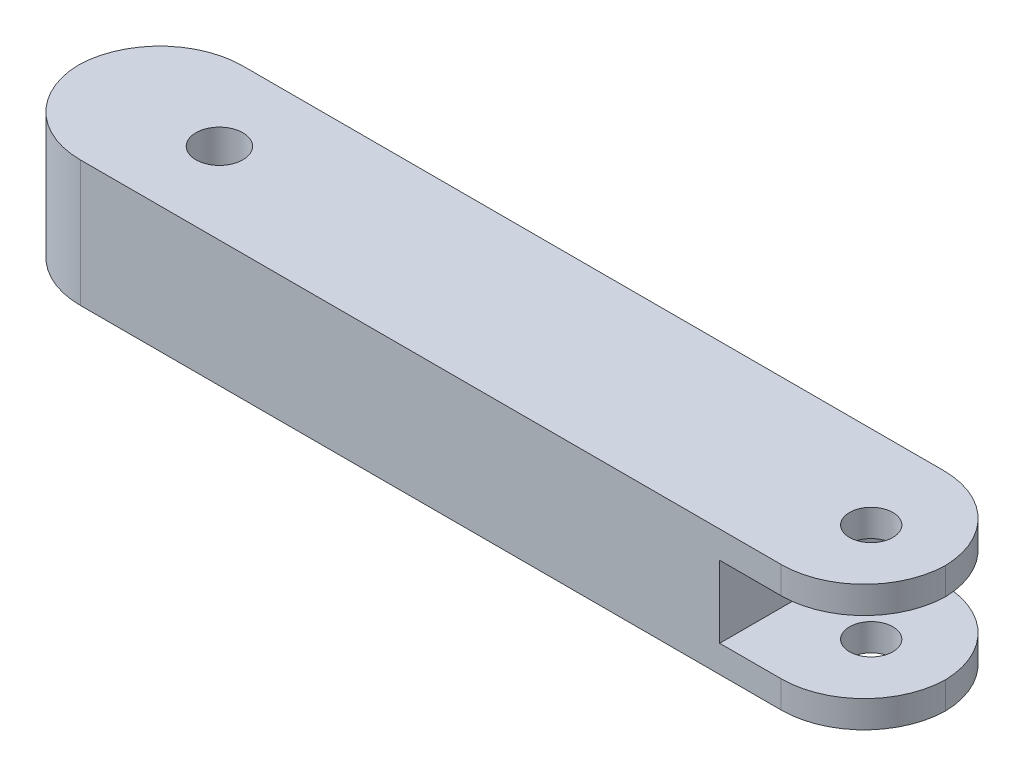
from build123d import *

# Parameters (mm, degrees)
SKETCH1_W           = 240
SKETCH1_H           = 45
BOSS_EXTRUDE1_DEPTH = 34.9
FILLET1_R           = 23
CUT_EXTRUDE1_START  = -7.5
SKETCH2_W           = 49.564850137
SKETCH2_H           = 45.01227926
CUT_EXTRUDE1_DEPTH  = 19.9
SKETCH3_R           = 6
CUT_EXTRUDE2_DEPTH  = 154.260575491
SKETCH4_R           = 6.5
CUT_EXTRUDE3_DEPTH  = 154.260575491
SCALE1_SCALE        = 0.31


with BuildPart() as part:
    # Sketch1 → Boss-Extrude1 (new body)
    with BuildSketch(Plane(origin=(0, 0, 0), x_dir=(1, 0, 0), z_dir=(0, 1, 0))):
        with Locations((24.613815765, -14.36746988)):
            Rectangle(SKETCH1_W, SKETCH1_H)
    extrude(amount=BOSS_EXTRUDE1_DEPTH)

    # Fillet1
    # the kernel refuses this fillet: 23 mm, written as the material it takes off along each edge
    with BuildSketch(Plane(origin=(-95.386184235, -57.5, 36.86746988), x_dir=(1, 0, 0), z_dir=(0, 1, 0))) as fillet1_piece_1:
        with BuildLine():
            CenterArc((FILLET1_R, FILLET1_R), FILLET1_R, 180, 90)
            Line((0, FILLET1_R), (0, 0))
            Line((0, 0), (FILLET1_R, 0))
        make_face()
    extrude(amount=149.9, mode=Mode.SUBTRACT)
    with BuildSketch(Plane(origin=(-95.386184235, -57.5, -8.13253012), x_dir=(1, 0, 0), z_dir=(0, 1, 0)), Plane(origin=(144.613815765, -57.5, 36.86746988), x_dir=(-1, 0, 0), z_dir=(0, 1, 0)), Plane(origin=(144.613815765, -57.5, -8.13253012), x_dir=(0, 0, 1), z_dir=(0, 1, 0))) as fillet1_piece_2:
        with BuildLine():
            CenterArc((FILLET1_R, -FILLET1_R), FILLET1_R, 90, 90)
            Line((0, -FILLET1_R), (0, 0))
            Line((0, 0), (FILLET1_R, 0))
        make_face()
    extrude(amount=149.9, mode=Mode.SUBTRACT)

    # Sketch2 → Cut-Extrude1 (cut)
    with BuildSketch(Plane(origin=(0, 34.9, 0), x_dir=(1, 0, 0), z_dir=(0, 1, 0)).offset(CUT_EXTRUDE1_START)):
        with Locations((129.390805409, -14.37360951)):
            Rectangle(SKETCH2_W, SKETCH2_H)
    extrude(amount=-CUT_EXTRUDE1_DEPTH, mode=Mode.SUBTRACT)

    # Sketch3 → Cut-Extrude2 (cut, through all)
    with BuildSketch(Plane.XZ):
        with Locations(Location((124.60838034, 14.935006331, 0), (0, 0, 270))):
            Circle(SKETCH3_R)
    extrude(amount=-CUT_EXTRUDE2_DEPTH, mode=Mode.SUBTRACT)

    # Sketch4 → Cut-Extrude3 (cut, through all)
    with BuildSketch(Plane.XZ):
        with Locations(Location((-56.380748811, 14.36746988, 0), (0, 0, 270))):
            Circle(SKETCH4_R)
    extrude(amount=-CUT_EXTRUDE3_DEPTH, mode=Mode.SUBTRACT)


with BuildPart() as part_1:
    # Scale1: scaled about (0, 0, 0)
    add(part.part.scale(SCALE1_SCALE))


solid = part_1.part
